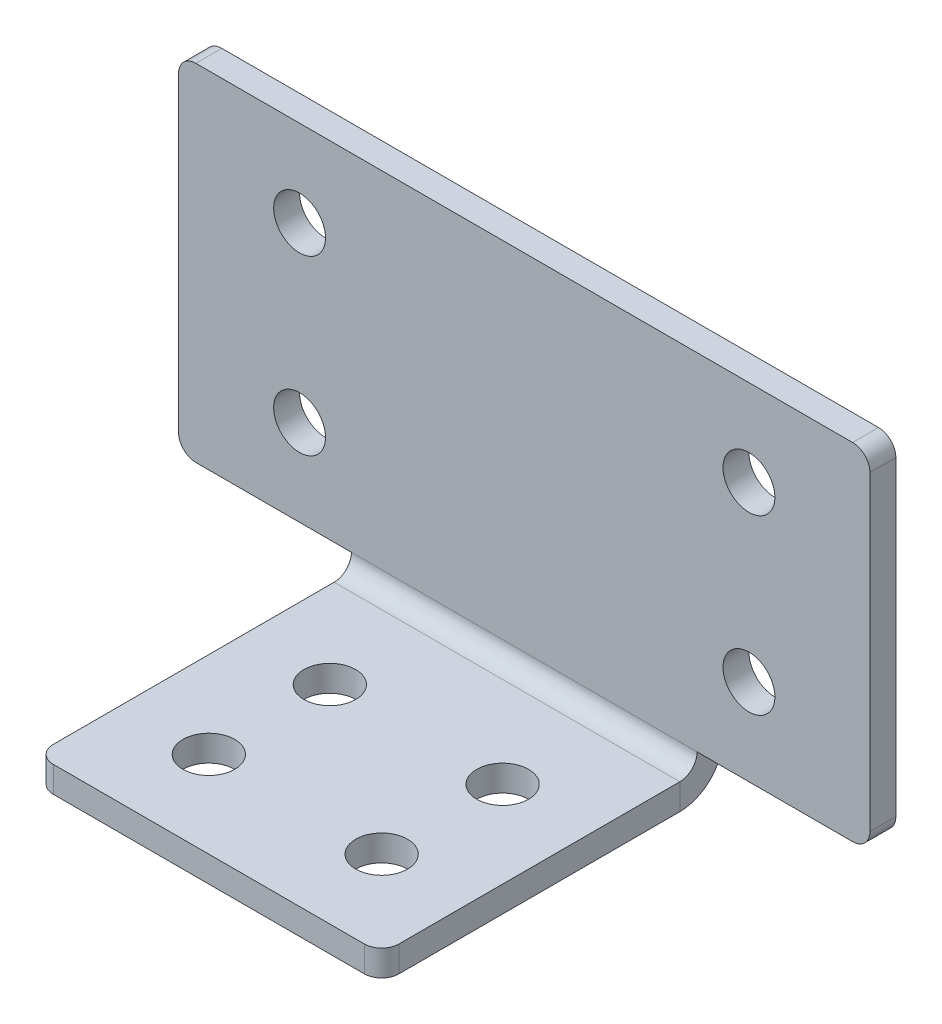
from build123d import *

# Parameters (mm, degrees)
SM_BASE_FLANGE_1_DEPTH = 1.5
OTHER_START            = -10
OTHER_1_DEPTH          = 20
OTHER_1_2_DEPTH        = 20
FILLET_1_R             = 1
SKETCH_7_R             = 1.5
CUT_EXTRUDE_1_DEPTH    = 10
SKETCH_8_R             = 1.5
CUT_EXTRUDE_2_DEPTH    = 10


# Read off the part's stored shape, not the designer's step: 绘制的折弯1
# Sheet-metal steps are written as plain solids
with BuildPart() as part:
    # Sketch 1 → 基体-法兰1 (new body)
    with BuildSketch(Plane.XY):
        Polygon((10, 10), (20, 10), (20, 30), (-20, 30), (-20, 10), (-10, 10), (-10, -10), (10, -10), align=None)
    extrude(amount=-SM_BASE_FLANGE_1_DEPTH)

    # Other 1 outline → Other 1 (cut)
    with BuildSketch(Plane.YZ.offset(OTHER_START)):
        with BuildLine():
            ThreePointArc((10, -1.5), (8.630693606, -1.091650066), (7.708712152, 0))
            Line((7.708712152, 0), (-10, 0))
            Line((-10, 0), (-10, -1.5))
            Line((-10, -1.5), (10, -1.5))
        make_face()
    extrude(amount=OTHER_1_DEPTH, mode=Mode.SUBTRACT)

    # Other 1 2 outline → Other 1 2 (add)
    with BuildSketch(Plane.YZ.offset(OTHER_START)):
        with BuildLine():
            Line((9, 18.251106428), (7.5, 18.251106428))
            Line((7.5, 18.251106428), (7.5, 1))
            ThreePointArc((7.5, 1), (7.552734218, 0.489225891), (7.708712152, 0))
            Line((7.708712152, 0), (10, 0))
            ThreePointArc((10, 0), (9.292893219, 0.292893219), (9, 1))
            Line((9, 1), (9, 18.251106428))
        make_face()
    extrude(amount=OTHER_1_2_DEPTH)

    # 圆角1
    fillet_1_edges = [part.edges().sort_by_distance(p)[0] for p in [
        (10, 8.25, 18.251106428),
        (-10, 8.25, 18.251106428),
        (20, 30, -0.75),
        (-20, 30, -0.75),
        (-20, 10, -0.75),
        (20, 10, -0.75),
    ]]
    fillet(fillet_1_edges, radius=FILLET_1_R)

    # 草图7 → 切除-拉伸1 (cut)
    with BuildSketch(Plane(origin=(0, 0, -1.5), x_dir=(-1, 0, 0), z_dir=(0, 0, -1))):
        with Locations((-13, 25)):
            Circle(SKETCH_7_R)
        with Locations((13, 25)):
            Circle(SKETCH_7_R)
        with Locations((-13, 15)):
            Circle(SKETCH_7_R)
        with Locations((13, 15)):
            Circle(SKETCH_7_R)
    extrude(amount=-CUT_EXTRUDE_1_DEPTH, mode=Mode.SUBTRACT)

    # 草图8 → 切除-拉伸2 (cut)
    with BuildSketch(Plane.XZ.offset(-7.5)):
        with Locations(Location((-5, 13.251106428, 0), (0, 0, 270))):
            Circle(SKETCH_8_R)
        with Locations(Location((5, 13.251106428, 0), (0, 0, 270))):
            Circle(SKETCH_8_R)
        with Locations(Location((-5, 6.251106428, 0), (0, 0, 270))):
            Circle(SKETCH_8_R)
        with Locations(Location((5, 6.251106428, 0), (0, 0, 270))):
            Circle(SKETCH_8_R)
    extrude(amount=-CUT_EXTRUDE_2_DEPTH, mode=Mode.SUBTRACT)


solid = part.part
